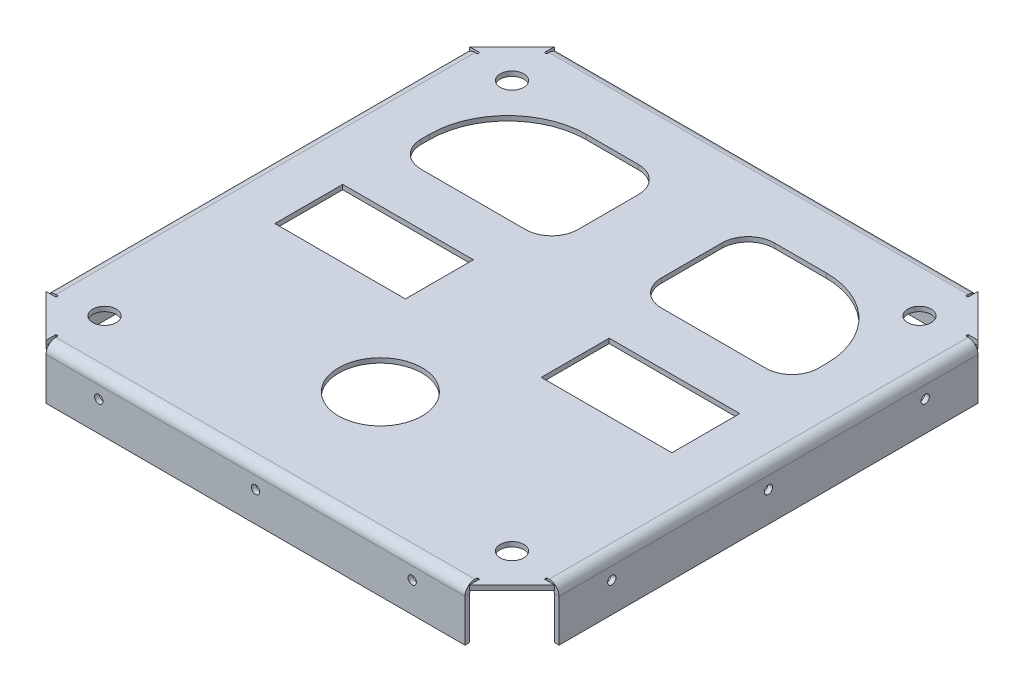
from build123d import *

# Parameters (mm, degrees)
SKETCH1_W                       = 25
SKETCH1_H                       = 13
BASE_FLANGE1_DEPTH              = 0.9
EDGE_FLANGE1_STRIP_W            = 5.6
EDGE_FLANGE1_STRIP_H            = 0.9
EDGE_FLANGE1_STRIP_CUT_DEPTH    = 80.2
EDGE_FLANGE1_RELIEF_W           = 6.05
EDGE_FLANGE1_RELIEF_H           = 0.45
EDGE_FLANGE1_RELIEF_CUT_DEPTH   = 0.9
EDGE_FLANGE1_STRIP_2_W          = 5.6
EDGE_FLANGE1_STRIP_2_H          = 0.9
EDGE_FLANGE1_STRIP_CUT_2_DEPTH  = 80.2
EDGE_FLANGE1_RELIEF_2_W         = 6.05
EDGE_FLANGE1_RELIEF_2_H         = 0.45
EDGE_FLANGE1_RELIEF_CUT_2_DEPTH = 0.9
EDGE_FLANGE1_STRIP_3_W          = 5.6
EDGE_FLANGE1_STRIP_3_H          = 0.9
EDGE_FLANGE1_STRIP_CUT_3_DEPTH  = 80.2
EDGE_FLANGE1_RELIEF_3_W         = 6.05
EDGE_FLANGE1_RELIEF_3_H         = 0.45
EDGE_FLANGE1_RELIEF_CUT_3_DEPTH = 0.9
EDGE_FLANGE1_STRIP_4_W          = 5.6
EDGE_FLANGE1_STRIP_4_H          = 0.9
EDGE_FLANGE1_STRIP_CUT_4_DEPTH  = 80.2
EDGE_FLANGE1_RELIEF_4_W         = 6.05
EDGE_FLANGE1_RELIEF_4_H         = 0.45
EDGE_FLANGE1_RELIEF_CUT_4_DEPTH = 0.9
EDGE_FLANGE1_DEPTH              = 80.2
EDGE_FLANGE1_BEND_DEPTH         = 80.2
EDGE_FLANGE1_BEND_2_DEPTH       = 80.2
EDGE_FLANGE1_BEND_3_DEPTH       = 80.2
SKETCH18_R                      = 8
CUT_EXTRUDE1_DEPTH              = 10
M2X0_4_TAPPED_HOLE1_D           = 1.6
M2X0_4_TAPPED_HOLE1_DEPTH       = 5.2
M2X0_4_TAPPED_HOLE1_TIP         = 0.480688495
M2X0_4_TAPPED_HOLE2_D           = 1.6
M2X0_4_TAPPED_HOLE2_DEPTH       = 5.2
M2X0_4_TAPPED_HOLE2_TIP         = 0.480688495
M2X0_4_TAPPED_HOLE3_D           = 1.6
M2X0_4_TAPPED_HOLE3_DEPTH       = 5.2
M2X0_4_TAPPED_HOLE3_TIP         = 0.480688495
M2X0_4_TAPPED_HOLE4_D           = 1.6
M2X0_4_TAPPED_HOLE4_DEPTH       = 5.2
M2X0_4_TAPPED_HOLE4_TIP         = 0.480688495
M4_CLEARANCE_HOLE1_D            = 4.5


# Sheet-metal steps are written as plain solids
with BuildPart() as part:
    # Sketch1 → Base-Flange1 (new body)
    with BuildSketch(Plane(origin=(0, 0, 0), x_dir=(1, 0, 0), z_dir=(0, 1, 0))):
        Polygon((9, 98.2), (0, 89.2), (0, 9), (9, 0), (89.2, 0), (98.2, 9), (98.2, 89.2), (89.2, 98.2), align=None)
        with Locations((74.6, 48.2)):
            Rectangle(SKETCH1_W, SKETCH1_H, mode=Mode.SUBTRACT)
        with Locations((23.6, 48.2)):
            Rectangle(SKETCH1_W, SKETCH1_H, mode=Mode.SUBTRACT)
    extrude(amount=-BASE_FLANGE1_DEPTH)

    # Edge-Flange1 strip (across the edge) → Edge-Flange1 strip cut (cut)
    with BuildSketch(Plane(origin=(98.2, -0.9, -89.2), x_dir=(-1, 0, 0), z_dir=(0, 0, 1))):
        with Locations((-0.9, -0.45)):
            Rectangle(EDGE_FLANGE1_STRIP_W, EDGE_FLANGE1_STRIP_H)
    extrude(amount=EDGE_FLANGE1_STRIP_CUT_DEPTH, mode=Mode.SUBTRACT)

    # Edge-Flange1 relief (on the sheet) → Edge-Flange1 relief cut (cut)
    with BuildSketch(Plane(origin=(96.3, -0.9, -89.2), x_dir=(-1, 0, 0), z_dir=(0, -1, 0))):
        with Locations((-2.575, 0.225)):
            Rectangle(EDGE_FLANGE1_RELIEF_W, EDGE_FLANGE1_RELIEF_H)
        with Locations((-2.575, -80.425)):
            Rectangle(EDGE_FLANGE1_RELIEF_W, EDGE_FLANGE1_RELIEF_H)
    extrude(amount=-EDGE_FLANGE1_RELIEF_CUT_DEPTH, mode=Mode.SUBTRACT)

    # Edge-Flange1 strip 2 (across the edge) → Edge-Flange1 strip cut 2 (cut)
    with BuildSketch(Plane(origin=(89.2, -0.9, 0), x_dir=(0, 0, -1), z_dir=(-1, 0, 0))):
        with Locations((-0.9, -0.45)):
            Rectangle(EDGE_FLANGE1_STRIP_2_W, EDGE_FLANGE1_STRIP_2_H)
    extrude(amount=EDGE_FLANGE1_STRIP_CUT_2_DEPTH, mode=Mode.SUBTRACT)

    # Edge-Flange1 relief 2 (on the sheet) → Edge-Flange1 relief cut 2 (cut)
    with BuildSketch(Plane(origin=(89.2, -0.9, -1.9), x_dir=(0, 0, -1), z_dir=(0, -1, 0))):
        with Locations((-2.575, 0.225)):
            Rectangle(EDGE_FLANGE1_RELIEF_2_W, EDGE_FLANGE1_RELIEF_2_H)
        with Locations((-2.575, -80.425)):
            Rectangle(EDGE_FLANGE1_RELIEF_2_W, EDGE_FLANGE1_RELIEF_2_H)
    extrude(amount=-EDGE_FLANGE1_RELIEF_CUT_2_DEPTH, mode=Mode.SUBTRACT)

    # Edge-Flange1 strip 3 (across the edge) → Edge-Flange1 strip cut 3 (cut)
    with BuildSketch(Plane(origin=(0, -0.9, -9), x_dir=(1, 0, 0), z_dir=(0, 0, -1))):
        with Locations((-0.9, -0.45)):
            Rectangle(EDGE_FLANGE1_STRIP_3_W, EDGE_FLANGE1_STRIP_3_H)
    extrude(amount=EDGE_FLANGE1_STRIP_CUT_3_DEPTH, mode=Mode.SUBTRACT)

    # Edge-Flange1 relief 3 (on the sheet) → Edge-Flange1 relief cut 3 (cut)
    with BuildSketch(Plane(origin=(1.9, -0.9, -9), x_dir=(1, 0, 0), z_dir=(0, -1, 0))):
        with Locations((-2.575, 0.225)):
            Rectangle(EDGE_FLANGE1_RELIEF_3_W, EDGE_FLANGE1_RELIEF_3_H)
        with Locations((-2.575, -80.425)):
            Rectangle(EDGE_FLANGE1_RELIEF_3_W, EDGE_FLANGE1_RELIEF_3_H)
    extrude(amount=-EDGE_FLANGE1_RELIEF_CUT_3_DEPTH, mode=Mode.SUBTRACT)

    # Edge-Flange1 strip 4 (across the edge) → Edge-Flange1 strip cut 4 (cut)
    with BuildSketch(Plane(origin=(9, -0.9, -98.2), x_dir=(0, 0, 1), z_dir=(1, 0, 0))):
        with Locations((-0.9, -0.45)):
            Rectangle(EDGE_FLANGE1_STRIP_4_W, EDGE_FLANGE1_STRIP_4_H)
    extrude(amount=EDGE_FLANGE1_STRIP_CUT_4_DEPTH, mode=Mode.SUBTRACT)

    # Edge-Flange1 relief 4 (on the sheet) → Edge-Flange1 relief cut 4 (cut)
    with BuildSketch(Plane(origin=(9, -0.9, -96.3), x_dir=(0, 0, 1), z_dir=(0, -1, 0))):
        with Locations((-2.575, 0.225)):
            Rectangle(EDGE_FLANGE1_RELIEF_4_W, EDGE_FLANGE1_RELIEF_4_H)
        with Locations((-2.575, -80.425)):
            Rectangle(EDGE_FLANGE1_RELIEF_4_W, EDGE_FLANGE1_RELIEF_4_H)
    extrude(amount=-EDGE_FLANGE1_RELIEF_CUT_4_DEPTH, mode=Mode.SUBTRACT)

    # Edge-Flange1 section (across the edge) → Edge-Flange1 (add)
    with BuildSketch(Plane(origin=(98.2, -0.9, -89.2), x_dir=(-1, 0, 0), z_dir=(0, 0, 1))):
        with BuildLine():
            Line((0, 1), (0, 9.1))
            Line((0, 9.1), (0.9, 9.1))
            Line((0.9, 9.1), (0.9, 1))
            ThreePointArc((0.9, 1), (1.192893219, 0.292893219), (1.9, 0))
            Line((1.9, 0), (1.9, -0.9))
            ThreePointArc((1.9, -0.9), (0.556497116, -0.343502884), (0, 1))
        make_face()
    extrude(amount=EDGE_FLANGE1_DEPTH)

    # Edge-Flange1 section 2 (across the edge) → Edge-Flange1 bend (add)
    with BuildSketch(Plane(origin=(89.2, -0.9, 0), x_dir=(0, 0, -1), z_dir=(-1, 0, 0))):
        with BuildLine():
            Line((0, 1), (0, 9.1))
            Line((0, 9.1), (0.9, 9.1))
            Line((0.9, 9.1), (0.9, 1))
            ThreePointArc((0.9, 1), (1.192893219, 0.292893219), (1.9, 0))
            Line((1.9, 0), (1.9, -0.9))
            ThreePointArc((1.9, -0.9), (0.556497116, -0.343502884), (0, 1))
        make_face()
    extrude(amount=EDGE_FLANGE1_BEND_DEPTH)

    # Edge-Flange1 section 3 (across the edge) → Edge-Flange1 bend 2 (add)
    with BuildSketch(Plane(origin=(0, -0.9, -9), x_dir=(1, 0, 0), z_dir=(0, 0, -1))):
        with BuildLine():
            Line((0, 1), (0, 9.1))
            Line((0, 9.1), (0.9, 9.1))
            Line((0.9, 9.1), (0.9, 1))
            ThreePointArc((0.9, 1), (1.192893219, 0.292893219), (1.9, 0))
            Line((1.9, 0), (1.9, -0.9))
            ThreePointArc((1.9, -0.9), (0.556497116, -0.343502884), (0, 1))
        make_face()
    extrude(amount=EDGE_FLANGE1_BEND_2_DEPTH)

    # Edge-Flange1 section 4 (across the edge) → Edge-Flange1 bend 3 (add)
    with BuildSketch(Plane(origin=(9, -0.9, -98.2), x_dir=(0, 0, 1), z_dir=(1, 0, 0))):
        with BuildLine():
            Line((0, 1), (0, 9.1))
            Line((0, 9.1), (0.9, 9.1))
            Line((0.9, 9.1), (0.9, 1))
            ThreePointArc((0.9, 1), (1.192893219, 0.292893219), (1.9, 0))
            Line((1.9, 0), (1.9, -0.9))
            ThreePointArc((1.9, -0.9), (0.556497116, -0.343502884), (0, 1))
        make_face()
    extrude(amount=EDGE_FLANGE1_BEND_3_DEPTH)

    # Sketch18 → Cut-Extrude1 (cut)
    with BuildSketch(Plane(origin=(0, 0, 0), x_dir=(1, 0, 0), z_dir=(0, 1, 0))):
        with Locations(Location((49.1, 23.9, 0), (0, 0, 270))):
            Circle(SKETCH18_R)
        with BuildLine():
            Line((11.1, 69.7), (11.1, 71.3))
            ThreePointArc((11.1, 71.3), (15.493398282, 81.906601718), (26.1, 86.3))
            Line((26.1, 86.3), (36.1, 86.3))
            ThreePointArc((36.1, 86.3), (39.635533906, 84.835533906), (41.1, 81.3))
            Line((41.1, 81.3), (41.1, 69.7))
            ThreePointArc((41.1, 69.7), (39.635533906, 66.164466094), (36.1, 64.7))
            Line((36.1, 64.7), (16.1, 64.7))
            ThreePointArc((16.1, 64.7), (12.564466094, 66.164466094), (11.1, 69.7))
        make_face()
        with BuildLine():
            Line((62.1, 64.7), (82.1, 64.7))
            ThreePointArc((82.1, 64.7), (85.635533906, 66.164466094), (87.1, 69.7))
            Line((87.1, 69.7), (87.1, 71.3))
            ThreePointArc((87.1, 71.3), (82.706601718, 81.906601718), (72.1, 86.3))
            Line((72.1, 86.3), (62.1, 86.3))
            ThreePointArc((62.1, 86.3), (58.564466094, 84.835533906), (57.1, 81.3))
            Line((57.1, 81.3), (57.1, 69.7))
            ThreePointArc((57.1, 69.7), (58.564466094, 66.164466094), (62.1, 64.7))
        make_face()
    extrude(amount=-CUT_EXTRUDE1_DEPTH, mode=Mode.SUBTRACT)

    # M2x0.4 Tapped Hole1
    with Locations(Plane(origin=(102.384287404, -9.723815531, 0), x_dir=(1, 0, 0), z_dir=(0, 0, 1))):
        with Locations((-83.284287404, 5.473815531), (-53.284287404, 5.473815531), (-23.284287404, 5.473815531)):
            Hole(M2X0_4_TAPPED_HOLE1_D / 2, depth=M2X0_4_TAPPED_HOLE1_DEPTH)
            with Locations((0, 0, -(M2X0_4_TAPPED_HOLE1_DEPTH + M2X0_4_TAPPED_HOLE1_TIP / 2))):  # 118° drill point
                Cone(0, M2X0_4_TAPPED_HOLE1_D / 2, M2X0_4_TAPPED_HOLE1_TIP, mode=Mode.SUBTRACT)

    # M2x0.4 Tapped Hole2
    with Locations(Plane(origin=(0, -9.723815531, -74.008101688), x_dir=(0, 0, 1), z_dir=(-1, 0, 0))):
        with Locations((54.908101688, 5.473815531), (24.908101688, 5.473815531), (-5.091898312, 5.473815531)):
            Hole(M2X0_4_TAPPED_HOLE2_D / 2, depth=M2X0_4_TAPPED_HOLE2_DEPTH)
            with Locations((0, 0, -(M2X0_4_TAPPED_HOLE2_DEPTH + M2X0_4_TAPPED_HOLE2_TIP / 2))):  # 118° drill point
                Cone(0, M2X0_4_TAPPED_HOLE2_D / 2, M2X0_4_TAPPED_HOLE2_TIP, mode=Mode.SUBTRACT)

    # M2x0.4 Tapped Hole3
    with Locations(Plane(origin=(102.384287404, -9.723815531, -98.2), x_dir=(-1, 0, 0), z_dir=(0, 0, -1))):
        with Locations((23.284287404, 5.473815531), (53.284287404, 5.473815531), (83.284287404, 5.473815531)):
            Hole(M2X0_4_TAPPED_HOLE3_D / 2, depth=M2X0_4_TAPPED_HOLE3_DEPTH)
            with Locations((0, 0, -(M2X0_4_TAPPED_HOLE3_DEPTH + M2X0_4_TAPPED_HOLE3_TIP / 2))):  # 118° drill point
                Cone(0, M2X0_4_TAPPED_HOLE3_D / 2, M2X0_4_TAPPED_HOLE3_TIP, mode=Mode.SUBTRACT)

    # M2x0.4 Tapped Hole4
    with Locations(Plane(origin=(98.2, -9.723815531, -74.008101688), x_dir=(0, 0, -1), z_dir=(1, 0, 0))):
        with Locations((-24.908101688, 5.473815531), (5.091898312, 5.473815531), (-54.908101688, 5.473815531)):
            Hole(M2X0_4_TAPPED_HOLE4_D / 2, depth=M2X0_4_TAPPED_HOLE4_DEPTH)
            with Locations((0, 0, -(M2X0_4_TAPPED_HOLE4_DEPTH + M2X0_4_TAPPED_HOLE4_TIP / 2))):  # 118° drill point
                Cone(0, M2X0_4_TAPPED_HOLE4_D / 2, M2X0_4_TAPPED_HOLE4_TIP, mode=Mode.SUBTRACT)

    # M4 Clearance Hole1 (through all)
    with Locations(Plane(origin=(102.384287404, 0, -74.008101688), x_dir=(1, 0, 0), z_dir=(0, 1, 0))):
        with Locations((-92.284287404, 14.091898312), (-92.284287404, -63.908101688), (-14.284287404, -63.908101688), (-14.284287404, 14.091898312)):
            Hole(M4_CLEARANCE_HOLE1_D / 2)


solid = part.part
